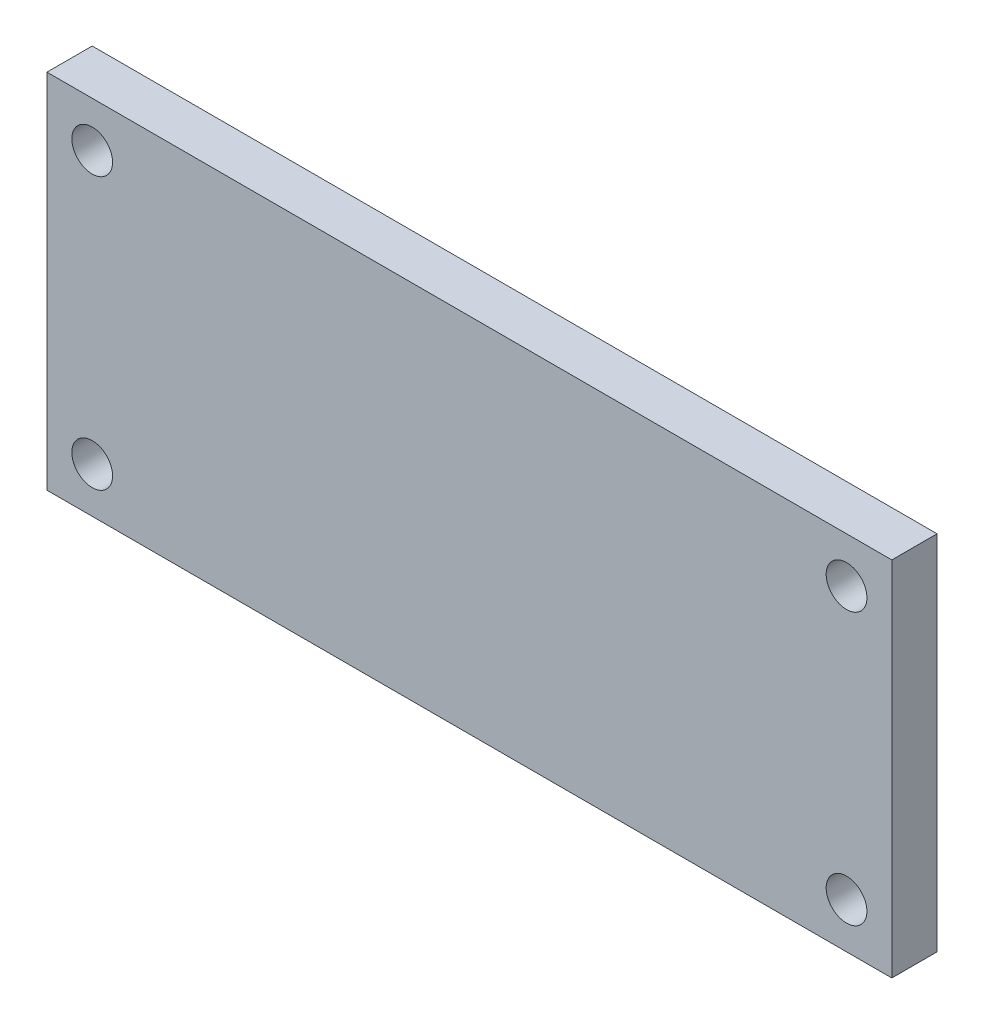
from build123d import *

# Parameters (mm, degrees)
SKETCH1_W           = 280
SKETCH1_H           = 120
SKETCH1_R           = 4.25
BOSS_EXTRUDE1_DEPTH = 15
SKETCH2_R           = 6.75
CUT_EXTRUDE1_DEPTH  = 10
CHAMFER2_SIZE       = 3
CHAMFER3_SIZE       = 3


with BuildPart() as part:
    # Sketch1 → Boss-Extrude1 (new body)
    with BuildSketch(Plane.XY):
        Rectangle(SKETCH1_W, SKETCH1_H)
        with Locations((-125, 45)):
            Circle(SKETCH1_R, mode=Mode.SUBTRACT)
        with Locations((125, 45)):
            Circle(SKETCH1_R, mode=Mode.SUBTRACT)
        with Locations((125, -45)):
            Circle(SKETCH1_R, mode=Mode.SUBTRACT)
        with Locations((-125, -45)):
            Circle(SKETCH1_R, mode=Mode.SUBTRACT)
    extrude(amount=BOSS_EXTRUDE1_DEPTH)

    # Sketch2 → Cut-Extrude1 (cut)
    with BuildSketch(Plane.XY.offset(15)):
        with Locations((-125, 45)):
            Circle(SKETCH2_R)
        with Locations((125, 45)):
            Circle(SKETCH2_R)
        with Locations((125, -45)):
            Circle(SKETCH2_R)
        with Locations((-125, -45)):
            Circle(SKETCH2_R)
    extrude(amount=-CUT_EXTRUDE1_DEPTH, mode=Mode.SUBTRACT)

    # Chamfer2
    # the kernel refuses this chamfer: 3 mm, written as the material it takes off along each edge
    with BuildSketch(Plane(origin=(-125, 45, 5), x_dir=(1, 0, 0), z_dir=(0, 1, 0))) as chamfer2_piece_1_section:
        Polygon((4.25, CHAMFER2_SIZE), (4.25 + CHAMFER2_SIZE, 0), (4.25, 0), align=None)
    chamfer2_piece_1 = revolve(axis=Axis((-125, 45, 5), (0, 0, -1)), mode=Mode.PRIVATE)
    chamfer2_piece_1 = chamfer2_piece_1 & Plane(origin=(-125, 45, 3.245521929), x_dir=(1, 0, 0), z_dir=(0, 0, 1)) * Cylinder(6.75, 29, mode=Mode.PRIVATE)
    add(chamfer2_piece_1, mode=Mode.SUBTRACT)

    # Chamfer3
    # the kernel refuses this chamfer: 3 mm, written as the material it takes off along each edge
    with BuildSketch(Plane(origin=(125, 45, 5), x_dir=(1, 0, 0), z_dir=(0, 1, 0))) as chamfer3_piece_1_section:
        Polygon((4.25 + CHAMFER3_SIZE, 0), (4.25, CHAMFER3_SIZE), (4.25, 0), align=None)
    chamfer3_piece_1 = revolve(axis=Axis((125, 45, 5), (0, 0, -1)), mode=Mode.PRIVATE)
    chamfer3_piece_1 = chamfer3_piece_1 & Plane(origin=(125, 45, 3.245521929), x_dir=(1, 0, 0), z_dir=(0, 0, 1)) * Cylinder(6.75, 29, mode=Mode.PRIVATE)
    add(chamfer3_piece_1, mode=Mode.SUBTRACT)
    with BuildSketch(Plane(origin=(125, -45, 5), x_dir=(1, 0, 0), z_dir=(0, 1, 0))) as chamfer3_piece_2_section:
        Polygon((4.25 + CHAMFER3_SIZE, 0), (4.25, CHAMFER3_SIZE), (4.25, 0), align=None)
    chamfer3_piece_2 = revolve(axis=Axis((125, -45, 5), (0, 0, -1)), mode=Mode.PRIVATE)
    chamfer3_piece_2 = chamfer3_piece_2 & Plane(origin=(125, -45, 3.245521929), x_dir=(1, 0, 0), z_dir=(0, 0, 1)) * Cylinder(6.75, 29, mode=Mode.PRIVATE)
    add(chamfer3_piece_2, mode=Mode.SUBTRACT)
    with BuildSketch(Plane(origin=(-125, -45, 5), x_dir=(1, 0, 0), z_dir=(0, 1, 0))) as chamfer3_piece_3_section:
        Polygon((4.25 + CHAMFER3_SIZE, 0), (4.25, CHAMFER3_SIZE), (4.25, 0), align=None)
    chamfer3_piece_3 = revolve(axis=Axis((-125, -45, 5), (0, 0, -1)), mode=Mode.PRIVATE)
    chamfer3_piece_3 = chamfer3_piece_3 & Plane(origin=(-125, -45, 3.245521929), x_dir=(1, 0, 0), z_dir=(0, 0, 1)) * Cylinder(6.75, 29, mode=Mode.PRIVATE)
    add(chamfer3_piece_3, mode=Mode.SUBTRACT)


solid = part.part
